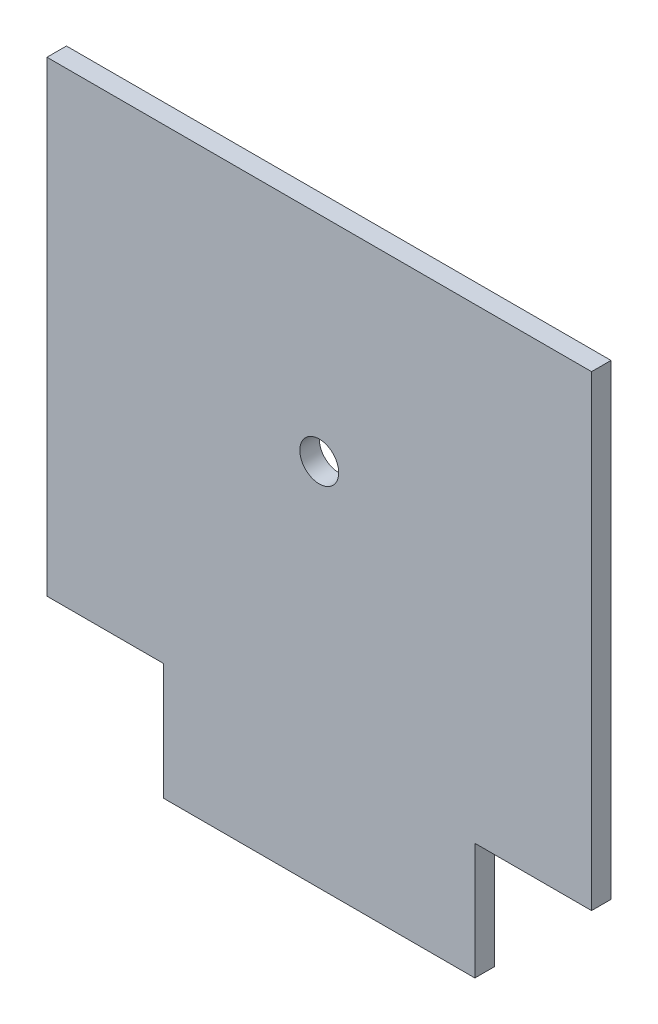
from build123d import *

# Parameters (mm, degrees)
BOSS_EXTRUDE1_DEPTH = 6.35
SKETCH3_W           = 203.2
SKETCH3_H           = 12.7
BOSS_EXTRUDE2_DEPTH = 76.2
CAVITY1_START       = -6.35
CAVITY1_OUTLINE_R   = 12.7
CAVITY1_DEPTH       = 12.7


# Read off the part's stored shape, not the designer's step: Cavity1
with BuildPart() as part:
    # Sketch1 → Boss-Extrude1 (new, symmetric)
    with BuildSketch(Plane.XY):
        Polygon((732.36, 381), (785.7, 381), (1001.6, 381), (1087.96, 381), (1087.96, 685.8), (1001.6, 685.8), (785.7, 685.8), (732.36, 685.8), align=None)
    extrude(amount=BOSS_EXTRUDE1_DEPTH, both=True)

    # Sketch3 → Boss-Extrude2 (add)
    with BuildSketch(Plane.XZ.offset(-381)):
        with Locations((910.16, 0)):
            Rectangle(SKETCH3_W, SKETCH3_H)
    extrude(amount=BOSS_EXTRUDE2_DEPTH)

    # Cavity1 outline → Cavity1 (cut)
    with BuildSketch(Plane.XY.offset(CAVITY1_START)):
        with Locations((910.16, 546.1)):
            Circle(CAVITY1_OUTLINE_R)
    extrude(amount=CAVITY1_DEPTH, mode=Mode.SUBTRACT)


solid = part.part
